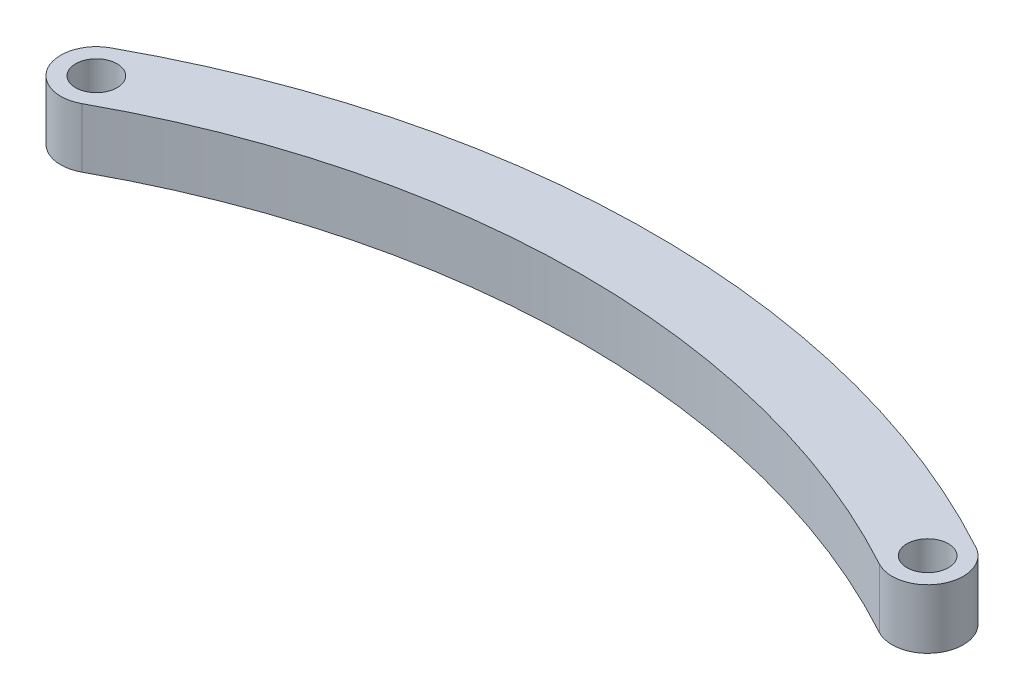
from build123d import *

# Parameters (mm, degrees)
ESQUISSE1_R        = 1.75
BOSS_EXTRU_1_DEPTH = 5


with BuildPart() as part:
    # Esquisse1 → Boss.-Extru.1 (new body)
    with BuildSketch(Plane(origin=(0, 0, 0), x_dir=(1, 0, 0), z_dir=(0, 1, 0))):
        with BuildLine():
            ThreePointArc((-36.438356038, 2.632704296), (-37.632704242, -1.438356135), (-33.561643767, -2.632704189))
            ThreePointArc((-33.561643767, -2.632704189), (6.8e-08, 5.937530488), (33.561643886, -2.632704254))
            ThreePointArc((33.561643886, -2.632704254), (37.632704286, -1.438356055), (36.438355996, 2.632704318))
            ThreePointArc((36.438355996, 2.632704318), (-2.4e-08, 11.937530488), (-36.438356038, 2.632704296))
        make_face()
        with Locations((-35, 0)):
            Circle(ESQUISSE1_R, mode=Mode.SUBTRACT)
        with Locations((35, 0)):
            Circle(ESQUISSE1_R, mode=Mode.SUBTRACT)
    extrude(amount=BOSS_EXTRU_1_DEPTH)


solid = part.part
